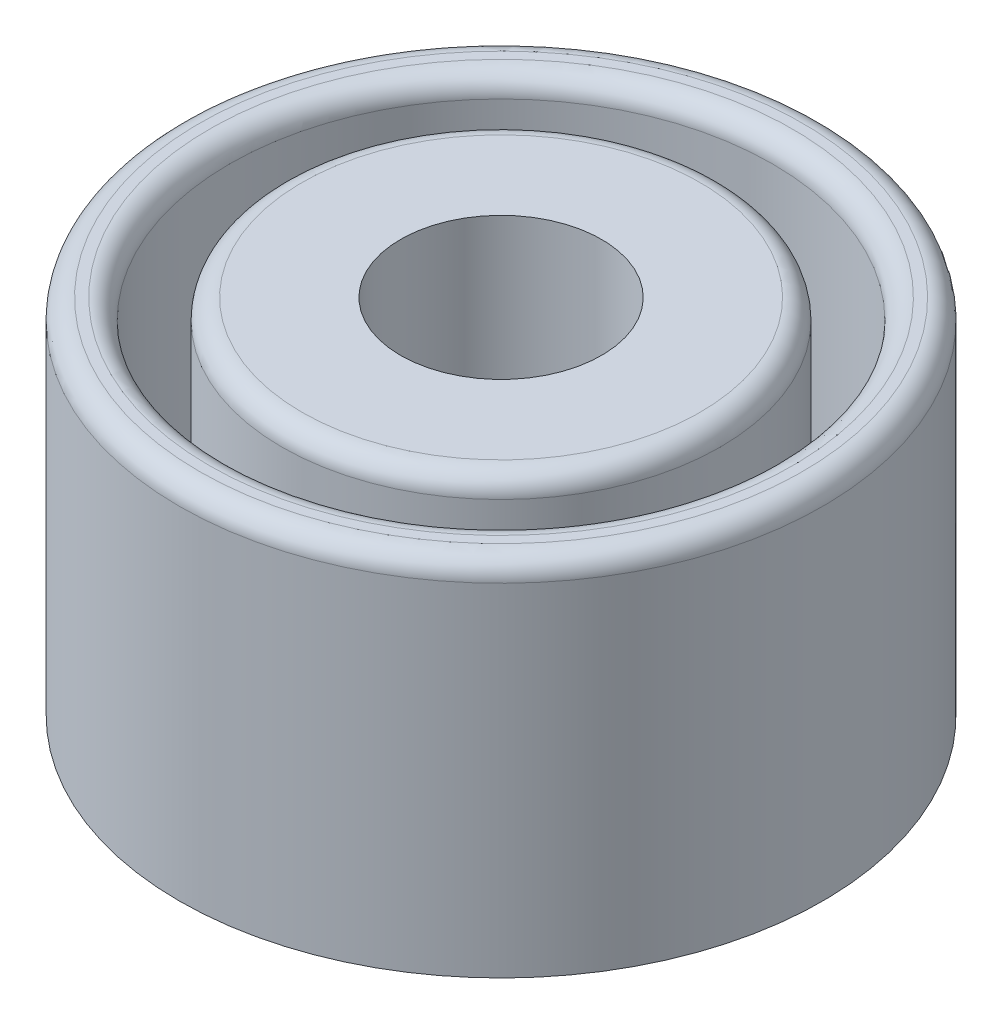
from build123d import *

# Parameters (mm, degrees)
SKETCH_1_R          = 16
EXTRUDE_1_DEPTH     = 18
SKETCH_2_R          = 13.5
SKETCH_2_R_2        = 10.9
SKETCH_2_R_3        = 5
CUT_EXTRUDE_1_DEPTH = 14
CUT_EXTRUDE_2_DEPTH = 1
FILLET_1_R          = 1


with BuildPart() as part:
    # 草圖1 → 填料-伸長1 (new body)
    with BuildSketch(Plane(origin=(0, 0, 0), x_dir=(1, 0, 0), z_dir=(0, 1, 0))):
        Circle(SKETCH_1_R)
    extrude(amount=EXTRUDE_1_DEPTH)

    # 草圖2 → 除料-伸長1 (cut)
    # profile 1 of 2: a face of its own
    with BuildSketch(Plane(origin=(0, 18, 0), x_dir=(1, 0, 0), z_dir=(0, 1, 0))):
        Circle(SKETCH_2_R)
        Circle(SKETCH_2_R_2, mode=Mode.SUBTRACT)
    # profile 2 of 2: a face of its own
    with BuildSketch(Plane(origin=(0, 18, 0), x_dir=(1, 0, 0), z_dir=(0, 1, 0))):
        Circle(SKETCH_2_R_3)
    extrude(amount=-CUT_EXTRUDE_1_DEPTH, mode=Mode.SUBTRACT)

    # 草圖3 → 除料-伸長2 (cut)
    with BuildSketch(Plane.XZ):
        with BuildLine():
            Line((0, -5.25), (0, -6.600740132))
            Line((0, -6.600740132), (-3.769736842, -9.001233553))
            add(Edge.make_bspline(
                [(-3.769736842, -9.001233553), (-3.821474081, -9.033829189), (-3.917540842, -9.094353431), (-4.051706948, -9.176624508), (-4.166594438, -9.240717015), (-4.236771826, -9.277271294), (-4.268092105, -9.293585526)],
                knots=[0, 0, 0, 0, 1.269529073, 2.357287452, 3.266854799, 4, 4, 4, 4], degree=3))
            Line((-4.268092105, -9.293585526), (-4.268092105, -9.309621711))
            add(Edge.make_bspline(
                [(-4.268092105, -9.309621711), (-4.239722195, -9.307146562), (-4.17971652, -9.301911334), (-4.084407741, -9.293770803), (-3.978610844, -9.289964278), (-3.86270089, -9.284435259), (-3.736446867, -9.280864257), (-3.599505977, -9.278909618), (-3.451904339, -9.275594385), (-3.349919819, -9.276070216), (-3.297286184, -9.276315789)],
                knots=[0, 0, 0, 0, 0.703373645, 1.487717424, 2.362034454, 3.317515189, 4.353823942, 5.481267207, 6.700096234, 8, 8, 8, 8], degree=3))
            Line((-3.297286184, -9.276315789), (0, -9.276315789))
            Line((0, -9.276315789), (0, -10.539473684))
            Line((0, -10.539473684), (-6, -10.539473684))
            Line((-6, -10.539473684), (-6, -9.097450658))
            Line((-6, -9.097450658), (-2.347450658, -6.788240132))
            add(Edge.make_bspline(
                [(-2.347450658, -6.788240132), (-2.266014162, -6.737012312), (-2.105045722, -6.635754735), (-1.93951591, -6.542141144), (-1.857730263, -6.495888158)],
                knots=[0, 0, 0, 0, 1.011831825, 2, 2, 2, 2], degree=3))
            Line((-1.857730263, -6.495888158), (-1.857730263, -6.479851974))
            add(Edge.make_bspline(
                [(-1.857730263, -6.479851974), (-1.877460719, -6.482358794), (-1.92056861, -6.487835797), (-1.99201853, -6.495953843), (-2.076078838, -6.499539176), (-2.17305805, -6.505189294), (-2.2820557, -6.508591721), (-2.404193137, -6.510630912), (-2.538637414, -6.51388283), (-2.632810303, -6.513405776), (-2.681743421, -6.513157895)],
                knots=[0, 0, 0, 0, 0.578461464, 1.263845826, 2.090348237, 3.024315, 4.089200952, 5.261350437, 6.576971935, 8, 8, 8, 8], degree=3))
            Line((-2.681743421, -6.513157895), (-6, -6.513157895))
            Line((-6, -6.513157895), (-6, -5.25))
            Line((-6, -5.25), (0, -5.25))
        make_face()
        with BuildLine():
            add(Edge.make_bspline(
                [(-0.244243421, 0.434210526), (-0.218442816, 0.377774347), (-0.165862827, 0.262761013), (-0.098923048, 0.080424968), (-0.044282582, -0.114886592), (0.0018114, -0.322341012), (0.035261169, -0.542951061), (0.06164173, -0.775366354), (0.076193659, -1.020783333), (0.07801357, -1.188304528), (0.078947368, -1.274259868)],
                knots=[0, 0, 0, 0, 0.849106584, 1.730425089, 2.654956727, 3.623062653, 4.637105135, 5.707279644, 6.823602232, 8, 8, 8, 8], degree=3))
            add(Edge.make_bspline(
                [(0.078947368, -1.274259868), (0.076832833, -1.385811969), (0.07270758, -1.603439306), (0.033187753, -1.920769823), (-0.028708617, -2.219901428), (-0.116466264, -2.501209405), (-0.230330402, -2.763710212), (-0.368906067, -3.008708183), (-0.534128121, -3.234320646), (-0.723288548, -3.44011453), (-0.932237664, -3.625519734), (-1.161212291, -3.784785363), (-1.40478987, -3.921796093), (-1.666665403, -4.031698181), (-1.944673531, -4.118074997), (-2.239616524, -4.17916057), (-2.550819115, -4.217067965), (-2.763868706, -4.221443871), (-2.872944079, -4.223684211)],
                knots=[0, 0, 0, 0, 1.134415969, 2.213135625, 3.24770366, 4.238660613, 5.205402917, 6.153363928, 7.096327649, 8.043780883, 8.992175599, 9.932202657, 10.876056719, 11.83016335, 12.815879449, 13.833211934, 14.890665713, 16, 16, 16, 16], degree=3))
            add(Edge.make_bspline(
                [(-2.872944079, -4.223684211), (-2.989444007, -4.22131296), (-3.217477425, -4.216671546), (-3.550625674, -4.173464135), (-3.866979447, -4.104709035), (-4.167057381, -4.008846821), (-4.449643569, -3.883460797), (-4.71572095, -3.730843413), (-4.964439978, -3.549841375), (-5.194327895, -3.342852977), (-5.402717967, -3.114562781), (-5.583344588, -2.866252532), (-5.73756366, -2.602513229), (-5.862186661, -2.321747459), (-5.960619992, -2.025255812), (-6.028441361, -1.711758321), (-6.072003968, -1.381983101), (-6.076599238, -1.156392597), (-6.078947368, -1.041118421)],
                knots=[0, 0, 0, 0, 1.100430489, 2.15394918, 3.168365747, 4.156295132, 5.125222395, 6.084283162, 7.0495575, 8.026306203, 9.002776648, 9.964909988, 10.922552958, 11.884380268, 12.862434181, 13.869261974, 14.91121716, 16, 16, 16, 16], degree=3))
            add(Edge.make_bspline(
                [(-6.078947368, -1.041118421), (-6.07831079, -0.969553115), (-6.077062447, -0.829212116), (-6.065098108, -0.623148978), (-6.049104855, -0.425415641), (-6.022280674, -0.236725034), (-5.991098614, -0.05619909), (-5.950914996, 0.1151896), (-5.906716232, 0.278991672), (-5.868359757, 0.383058865), (-5.849506579, 0.434210526)],
                knots=[0, 0, 0, 0, 1.144105001, 2.243612835, 3.299526181, 4.314830623, 5.289785371, 6.227522133, 7.128782247, 8, 8, 8, 8], degree=3))
            Line((-5.849506579, 0.434210526), (-4.5, 0.434210526))
            add(Edge.make_bspline(
                [(-4.5, 0.434210526), (-4.531592496, 0.383662068), (-4.594287028, 0.283349892), (-4.674824183, 0.125403394), (-4.742621109, -0.037570089), (-4.798516336, -0.206160725), (-4.841367556, -0.379862574), (-4.872344897, -0.55872893), (-4.891266485, -0.74259975), (-4.893571611, -0.867142743), (-4.894736842, -0.930098684)],
                knots=[0, 0, 0, 0, 0.992495252, 1.969582479, 2.948947272, 3.930034701, 4.92500798, 5.925973783, 6.951588772, 8, 8, 8, 8], degree=3))
            add(Edge.make_bspline(
                [(-4.894736842, -0.930098684), (-4.89291721, -0.998414893), (-4.889354709, -1.132165274), (-4.866188642, -1.328057848), (-4.825266357, -1.513855551), (-4.768707919, -1.68961375), (-4.695708283, -1.855380496), (-4.60469642, -2.009666237), (-4.499555104, -2.155578675), (-4.377517486, -2.289171921), (-4.242040381, -2.410651124), (-4.093290623, -2.515085979), (-3.934179851, -2.605889417), (-3.761833428, -2.67594875), (-3.579304243, -2.733683278), (-3.385120434, -2.774080751), (-3.179431473, -2.797294611), (-3.038710758, -2.800824888), (-2.966694079, -2.802631579)],
                knots=[0, 0, 0, 0, 1.081164585, 2.116718375, 3.11614911, 4.087453896, 5.034254148, 5.976211858, 6.917270067, 7.875451179, 8.834118285, 9.791039083, 10.746697905, 11.726790995, 12.729098648, 13.773062194, 14.860319435, 16, 16, 16, 16], degree=3))
            add(Edge.make_bspline(
                [(-2.966694079, -2.802631579), (-2.897528012, -2.80146082), (-2.762477492, -2.799174848), (-2.565548944, -2.774035739), (-2.378247666, -2.739023419), (-2.202921142, -2.683361815), (-2.03728492, -2.616268107), (-1.883704876, -2.531647195), (-1.740921426, -2.432122656), (-1.608883589, -2.31904717), (-1.490384766, -2.192128598), (-1.387823727, -2.052957712), (-1.299668969, -1.904435443), (-1.227246041, -1.74545986), (-1.17350877, -1.574941005), (-1.134534807, -1.394480265), (-1.108536174, -1.203463869), (-1.106371875, -1.072457002), (-1.105263158, -1.005345395)],
                knots=[0, 0, 0, 0, 1.13522519, 2.216589144, 3.256220275, 4.260124028, 5.232038226, 6.187054866, 7.133075858, 8.086013073, 9.036842334, 9.978224282, 10.91979998, 11.868780942, 12.840483975, 13.849824069, 14.898517574, 16, 16, 16, 16], degree=3))
            add(Edge.make_bspline(
                [(-1.105263158, -1.005345395), (-1.106415312, -0.94033261), (-1.108695202, -0.81168491), (-1.127901841, -0.620889598), (-1.158404141, -0.434557358), (-1.201881222, -0.252413038), (-1.257443472, -0.074321895), (-1.325695784, 0.099885995), (-1.405192176, 0.270609324), (-1.468327316, 0.379555868), (-1.5, 0.434210526)],
                knots=[0, 0, 0, 0, 1.032108678, 2.042343035, 3.041652638, 4.028254633, 5.013278289, 6.001434533, 6.997389842, 8, 8, 8, 8], degree=3))
            Line((-1.5, 0.434210526), (-0.244243421, 0.434210526))
        make_face()
        with BuildLine():
            Line((0, 6.355263158), (0, 4.6875))
            Line((0, 4.6875), (-2.606496711, 2.979029605))
            add(Edge.make_bspline(
                [(-2.606496711, 2.979029605), (-2.622823419, 2.969347847), (-2.661621259, 2.946340682), (-2.733968521, 2.912323568), (-2.82748482, 2.869448822), (-2.8983315, 2.839813981), (-2.937088816, 2.823601974)],
                knots=[0, 0, 0, 0, 0.622718141, 1.47979111, 2.621296995, 4, 4, 4, 4], degree=3))
            Line((-2.937088816, 2.823601974), (-2.937088816, 2.802631579))
            Line((-2.937088816, 2.802631579), (0, 2.802631579))
            Line((0, 2.802631579), (0, 1.460526316))
            Line((0, 1.460526316), (-6, 1.460526316))
            Line((-6, 1.460526316), (-6, 2.802631579))
            Line((-6, 2.802631579), (-3.162828947, 2.802631579))
            Line((-3.162828947, 2.802631579), (-3.162828947, 2.823601974))
            add(Edge.make_bspline(
                [(-3.162828947, 2.823601974), (-3.184711193, 2.83286256), (-3.232680255, 2.853163112), (-3.309522802, 2.891248629), (-3.399081031, 2.936630691), (-3.463026783, 2.969916809), (-3.497121711, 2.987664474)],
                knots=[0, 0, 0, 0, 0.765311676, 1.677674359, 2.761770366, 4, 4, 4, 4], degree=3))
            Line((-3.497121711, 2.987664474), (-6, 4.614720395))
            Line((-6, 4.614720395), (-6, 6.197368421))
            Line((-6, 6.197368421), (-3.138157895, 4.134868421))
            Line((-3.138157895, 4.134868421), (0, 6.355263158))
        make_face()
        with BuildLine():
            add(Edge.make_bspline(
                [(-2.612664474, 11.802631579), (-2.504055778, 11.800707762), (-2.29343936, 11.796977054), (-1.987342364, 11.769079699), (-1.702451636, 11.719813438), (-1.437883212, 11.652768201), (-1.195047973, 11.564929377), (-0.972362627, 11.459091368), (-0.771021546, 11.332575684), (-0.590535579, 11.186584165), (-0.432657828, 11.019137587), (-0.295084468, 10.833243185), (-0.178481676, 10.627800245), (-0.082984883, 10.403163539), (-0.011459271, 10.158592391), (0.042116805, 9.895877903), (0.072337517, 9.613367926), (0.076698652, 9.418655491), (0.078947368, 9.318256579)],
                knots=[0, 0, 0, 0, 1.240965896, 2.406508893, 3.508007427, 4.541607118, 5.521066614, 6.45412441, 7.353584193, 8.2319471, 9.099384733, 9.976137672, 10.868364943, 11.792543687, 12.758762419, 13.775121228, 14.852793314, 16, 16, 16, 16], degree=3))
            add(Edge.make_bspline(
                [(0.078947368, 9.318256579), (0.077269443, 9.220721494), (0.074017786, 9.031707992), (0.042815793, 8.757608671), (-0.008805883, 8.502525088), (-0.079496129, 8.265587129), (-0.172799283, 8.047568619), (-0.286295682, 7.848270153), (-0.420145981, 7.667264667), (-0.576515537, 7.507475934), (-0.751037552, 7.364087339), (-0.948098928, 7.241808218), (-1.165395059, 7.138075944), (-1.403058845, 7.053100375), (-1.661378894, 6.988217949), (-1.93944245, 6.942121967), (-2.237884902, 6.913342048), (-2.443599856, 6.909748887), (-2.549753289, 6.907894737)],
                knots=[0, 0, 0, 0, 1.144458973, 2.217850094, 3.232498872, 4.195865322, 5.114744916, 6.009675018, 6.882255349, 7.749171645, 8.627299912, 9.52716151, 10.464002344, 11.448651981, 12.484575869, 13.585846913, 14.754243992, 16, 16, 16, 16], degree=3))
            Line((-2.549753289, 6.907894737), (-6, 6.907894737))
            Line((-6, 6.907894737), (-6, 8.25))
            Line((-6, 8.25), (-2.548519737, 8.25))
            add(Edge.make_bspline(
                [(-2.548519737, 8.25), (-2.49011316, 8.251110608), (-2.377279157, 8.25325616), (-2.213228486, 8.265092079), (-2.060697226, 8.287011852), (-1.91949146, 8.318204246), (-1.788930085, 8.355505899), (-1.670086313, 8.403940853), (-1.562034263, 8.460669962), (-1.465137333, 8.525907799), (-1.380262763, 8.600695572), (-1.307109869, 8.684405186), (-1.242986906, 8.775874962), (-1.193130912, 8.877862741), (-1.15324921, 8.987395882), (-1.124614718, 9.105648504), (-1.109313739, 9.232739178), (-1.106635562, 9.320274853), (-1.105263158, 9.365131579)],
                knots=[0, 0, 0, 0, 1.346438129, 2.601145482, 3.788760408, 4.894951909, 5.932630741, 6.914756943, 7.847529227, 8.741349019, 9.600891552, 10.447056403, 11.298882346, 12.16783213, 13.055347926, 13.981790361, 14.965789935, 16, 16, 16, 16], degree=3))
            add(Edge.make_bspline(
                [(-1.105263158, 9.365131579), (-1.105879621, 9.409615031), (-1.107072056, 9.495660056), (-1.125687457, 9.620201388), (-1.151821794, 9.736662313), (-1.19030576, 9.844144398), (-1.238654742, 9.9436704), (-1.299605028, 10.033504365), (-1.37037639, 10.115930687), (-1.452715793, 10.189634325), (-1.546802222, 10.25279067), (-1.650455895, 10.309638396), (-1.765987429, 10.355515612), (-1.891483795, 10.39541491), (-2.028306639, 10.424565023), (-2.175516655, 10.444785236), (-2.333595746, 10.45929661), (-2.44280982, 10.460107696), (-2.499177632, 10.460526316)],
                knots=[0, 0, 0, 0, 1.053179615, 2.037181514, 2.97796347, 3.877990471, 4.736544919, 5.593327779, 6.443154989, 7.305847338, 8.203232634, 9.123295151, 10.10231424, 11.144070548, 12.241236036, 13.412662272, 14.66461747, 16, 16, 16, 16], degree=3))
            Line((-2.499177632, 10.460526316), (-6, 10.460526316))
            Line((-6, 10.460526316), (-6, 11.802631579))
            Line((-6, 11.802631579), (-2.612664474, 11.802631579))
        make_face()
        Polygon((9, -0.184210526), (9, -4.328947368), (2, -4.328947368), (2, -0.368421053), (3.289473684, -0.368421053), (3.289473684, -2.763157895), (4.855263158, -2.763157895), (4.855263158, -0.552631579), (6.144736842, -0.552631579), (6.144736842, -2.763157895), (7.710526316, -2.763157895), (7.710526316, -0.184210526), align=None)
        with BuildLine():
            Line((8.704975329, 0.644736842), (7.157894737, 0.644736842))
            add(Edge.make_bspline(
                [(7.157894737, 0.644736842), (7.216818852, 0.716634647), (7.333296824, 0.858758303), (7.482739787, 1.087730484), (7.610788809, 1.324720347), (7.713511836, 1.570480948), (7.794668577, 1.821292731), (7.851670713, 2.074211756), (7.888206145, 2.328430952), (7.892557718, 2.498233377), (7.894736842, 2.583264803)],
                knots=[0, 0, 0, 0, 1.052804814, 2.08112707, 3.092934838, 4.101597725, 5.095309197, 6.076510114, 7.036780032, 8, 8, 8, 8], degree=3))
            add(Edge.make_bspline(
                [(7.894736842, 2.583264803), (7.894514331, 2.631749475), (7.894084022, 2.725512744), (7.881475486, 2.860882913), (7.865125033, 2.986985488), (7.840243659, 3.103662563), (7.810643582, 3.211590653), (7.774374328, 3.310196184), (7.733222117, 3.399699735), (7.685194126, 3.479299287), (7.63357633, 3.549510959), (7.578832366, 3.612236065), (7.516159656, 3.661586489), (7.430700763, 3.717764649), (7.311082596, 3.765489998), (7.210176919, 3.772688635), (7.159333882, 3.776315789)],
                knots=[0, 0, 0, 0, 1.303156556, 2.520141182, 3.653067731, 4.720733637, 5.725444948, 6.66005054, 7.543018381, 8.370431175, 9.154790049, 9.885436482, 10.600660385, 11.291262941, 12.635156864, 14, 14, 14, 14], degree=3))
            add(Edge.make_bspline(
                [(7.159333882, 3.776315789), (7.126128501, 3.77495414), (7.060904536, 3.772279507), (6.965662553, 3.75044061), (6.877181032, 3.711565946), (6.792917482, 3.661387743), (6.715008146, 3.595856445), (6.638931075, 3.521737837), (6.566502087, 3.435719021), (6.472723152, 3.303147021), (6.359490143, 3.112125562), (6.232514383, 2.85453862), (6.108198562, 2.567044393), (6.025036436, 2.367016318), (5.982113487, 2.263774671)],
                knots=[0, 0, 0, 0, 0.590885399, 1.160651907, 1.727015259, 2.305611943, 2.900557612, 3.534735226, 4.19528236, 4.899241932, 6.424096351, 8.142971856, 10.009249751, 12, 12, 12, 12], degree=3))
            add(Edge.make_bspline(
                [(5.982113487, 2.263774671), (5.953308797, 2.197850973), (5.897102081, 2.069213774), (5.806706938, 1.883352801), (5.708791278, 1.712138487), (5.608394743, 1.552126549), (5.501375165, 1.407433712), (5.391857608, 1.272975331), (5.275816933, 1.153229144), (5.155671509, 1.045183046), (5.029348521, 0.950988307), (4.897100243, 0.86882637), (4.758381068, 0.799363506), (4.613193114, 0.743155707), (4.462156546, 0.698310883), (4.304186878, 0.666767544), (4.140006842, 0.647627875), (4.028286974, 0.645709663), (3.971628289, 0.644736842)],
                knots=[0, 0, 0, 0, 1.250796705, 2.440685068, 3.591069298, 4.678537236, 5.722832913, 6.718116851, 7.691385468, 8.618832383, 9.52461204, 10.427275937, 11.322472158, 12.217707233, 13.130829929, 14.058276845, 15.015255899, 16, 16, 16, 16], degree=3))
            add(Edge.make_bspline(
                [(3.971628289, 0.644736842), (3.884161065, 0.647547795), (3.714964448, 0.652985303), (3.470058272, 0.693557562), (3.244142069, 0.762083584), (3.038183489, 0.859860062), (2.85081954, 0.980829282), (2.680714529, 1.121933733), (2.528154061, 1.283795903), (2.393022614, 1.46413698), (2.274830088, 1.66212224), (2.174623368, 1.876168107), (2.089160601, 2.104094772), (2.022369013, 2.346581433), (1.971028748, 2.599617081), (1.936017403, 2.861724808), (1.911454976, 3.130153767), (1.909088527, 3.311895146), (1.907894737, 3.403577303)],
                knots=[0, 0, 0, 0, 1.081193571, 2.091461087, 3.059615448, 3.990964299, 4.900853393, 5.810703816, 6.717028349, 7.644743393, 8.591826235, 9.562956078, 10.5633717, 11.598156113, 12.669558861, 13.753385173, 14.866661557, 16, 16, 16, 16], degree=3))
            add(Edge.make_bspline(
                [(1.907894737, 3.403577303), (1.908815107, 3.492335114), (1.910601922, 3.664650446), (1.921761274, 3.915750181), (1.941909427, 4.150949407), (1.969110838, 4.372368193), (2.004945939, 4.581826553), (2.050207651, 4.78179614), (2.100446828, 4.974253191), (2.144014565, 5.09723942), (2.165501645, 5.157894737)],
                knots=[0, 0, 0, 0, 1.195237994, 2.320447403, 3.383723621, 4.373269299, 5.323774543, 6.243759987, 7.133843727, 8, 8, 8, 8], degree=3))
            Line((2.165501645, 5.157894737), (3.565789474, 5.157894737))
            add(Edge.make_bspline(
                [(3.565789474, 5.157894737), (3.528603019, 5.097149699), (3.452620133, 4.973029687), (3.360186069, 4.771972167), (3.279054192, 4.561127917), (3.215735363, 4.343136328), (3.164500351, 4.12323704), (3.131156719, 3.905194297), (3.110005036, 3.693260624), (3.106819601, 3.554733662), (3.105263158, 3.487047697)],
                knots=[0, 0, 0, 0, 0.973185875, 1.988505531, 3.020409709, 4.060289755, 5.089876897, 6.105810916, 7.074476093, 8, 8, 8, 8], degree=3))
            add(Edge.make_bspline(
                [(3.105263158, 3.487047697), (3.107437053, 3.401016684), (3.111616988, 3.235597419), (3.151577736, 3.00170206), (3.215885838, 2.797460221), (3.29945015, 2.623674398), (3.407526546, 2.485913253), (3.513238935, 2.397223527), (3.607135082, 2.348052586), (3.681536231, 2.322931429), (3.759800551, 2.305891016), (3.813229045, 2.303737481), (3.840666118, 2.302631579)],
                knots=[0, 0, 0, 0, 1.666466947, 3.204260012, 4.580445446, 5.807128679, 6.919489232, 7.950533572, 8.453750337, 8.965400775, 9.468703435, 10, 10, 10, 10], degree=3))
            add(Edge.make_bspline(
                [(3.840666118, 2.302631579), (3.869055596, 2.303709081), (3.924939617, 2.305830117), (4.006087029, 2.323427913), (4.082537639, 2.352985401), (4.181098013, 2.408632519), (4.296810013, 2.508305015), (4.42456081, 2.661991301), (4.544665897, 2.85333127), (4.663296866, 3.079594459), (4.783360604, 3.338599284), (4.860708229, 3.523706652), (4.901315789, 3.620888158)],
                knots=[0, 0, 0, 0, 0.477015902, 0.938994614, 1.388407889, 1.850668209, 2.83597041, 3.934910525, 5.201350743, 6.626749135, 8.229040782, 10, 10, 10, 10], degree=3))
            add(Edge.make_bspline(
                [(4.901315789, 3.620888158), (4.929993278, 3.688791451), (4.986390606, 3.822330489), (5.079413909, 4.014426893), (5.172117739, 4.197501639), (5.268795613, 4.36988087), (5.370201236, 4.530984901), (5.478634223, 4.679834874), (5.592561116, 4.816810197), (5.711831566, 4.943407875), (5.840685504, 5.055823684), (5.977036551, 5.156134197), (6.124065349, 5.239402178), (6.279112505, 5.310939653), (6.44565307, 5.368019843), (6.625551872, 5.405282978), (6.817499368, 5.431270388), (6.950083751, 5.433211721), (7.018297697, 5.434210526)],
                knots=[0, 0, 0, 0, 1.18199248, 2.324513772, 3.422167092, 4.472869502, 5.493130998, 6.473417632, 7.424028859, 8.349141086, 9.259645104, 10.163002174, 11.059089241, 11.96454075, 12.898821553, 13.8752056, 14.906804804, 16, 16, 16, 16], degree=3))
            add(Edge.make_bspline(
                [(7.018297697, 5.434210526), (7.1115377, 5.431570995), (7.291340843, 5.426480948), (7.548949382, 5.384242395), (7.78410202, 5.31635151), (7.994487119, 5.216335733), (8.184789999, 5.094598208), (8.355171487, 4.951506426), (8.50639111, 4.788182945), (8.638834214, 4.606355266), (8.752415158, 4.406454509), (8.848689957, 4.191344004), (8.928410515, 3.960742603), (8.989019591, 3.715768917), (9.033615623, 3.459167508), (9.069462617, 3.195285916), (9.087156165, 2.923625581), (9.090442311, 2.740630738), (9.092105263, 2.648026316)],
                knots=[0, 0, 0, 0, 1.135952241, 2.19055959, 3.172983935, 4.109504589, 5.019506516, 5.920217069, 6.813972225, 7.72628221, 8.656133761, 9.611470386, 10.5953034, 11.62638373, 12.683953761, 13.769037526, 14.871022878, 16, 16, 16, 16], degree=3))
            add(Edge.make_bspline(
                [(9.092105263, 2.648026316), (9.091168251, 2.552529147), (9.089320603, 2.364223), (9.069575762, 2.085265864), (9.039601643, 1.81349344), (8.998937778, 1.549990162), (8.944432706, 1.299180489), (8.879113413, 1.064144665), (8.800143529, 0.846574447), (8.736209939, 0.710980806), (8.704975329, 0.644736842)],
                knots=[0, 0, 0, 0, 1.113719809, 2.196089038, 3.260137412, 4.302409517, 5.30443291, 6.252114794, 7.146074671, 8, 8, 8, 8], degree=3))
        make_face()
    extrude(amount=-CUT_EXTRUDE_2_DEPTH, mode=Mode.SUBTRACT)

    # 圓角1
    fillet_1_edges = [part.edges().sort_by_distance(p)[0] for p in [
        (-16, 18, 0),
        (-13.5, 18, 0),
        (-10.9, 18, 0),
    ]]
    fillet(fillet_1_edges, radius=FILLET_1_R)


solid = part.part
